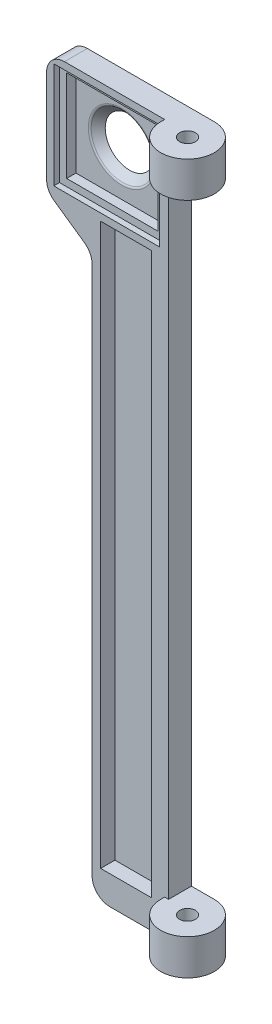
from build123d import *

# Parameters (mm, degrees)
SKETCH1_W           = 15.875
SKETCH1_H           = 125.984
SKETCH1_W_2         = 1.905
SKETCH1_H_2         = 115.824
BOSS_EXTRUDE1_DEPTH = 4.064
SKETCH2_W           = 7.112
SKETCH2_H           = 115.824
CUT_EXTRUDE1_DEPTH  = 2.54
FILLET1_R           = 0.508
BOSS_EXTRUDE2_START = -4.064
SKETCH3_W           = 23.9522
SKETCH3_H           = 21.336
BOSS_EXTRUDE2_DEPTH = 4.064
SKETCH4_W           = 16.256
SKETCH4_H           = 16.256
CUT_EXTRUDE2_DEPTH  = 2.667
SKETCH5_W           = 18.796
SKETCH5_H           = 18.796
CUT_EXTRUDE3_DEPTH  = 1.016
SKETCH6_R           = 5.715
CUT_EXTRUDE4_DEPTH  = 2.54
CUT_EXTRUDE4_DRAFT  = -45
CHAMFER1_SIZE       = 8.128
CHAMFER1_SIZE_2     = 5.691286871
FILLET3_R           = 3.175
FILLET4_R           = 0.508
SKETCH7_W           = 2.286
SKETCH7_H           = 113.284
CUT_EXTRUDE5_DEPTH  = 128.045267433
BOSS_EXTRUDE3_DEPTH = 6.35
BOSS_EXTRUDE4_DEPTH = 6.35
SKETCH10_R          = 1.397
CUT_EXTRUDE6_DEPTH  = 129.316594879


with BuildPart() as part:
    # Sketch1 → Boss-Extrude1 (new body)
    with BuildSketch(Plane.XY):
        with Locations((7.9375, 62.992)):
            Rectangle(SKETCH1_W, SKETCH1_H)
        with Locations((9.5885, 62.992)):
            Rectangle(SKETCH1_W_2, SKETCH1_H_2, mode=Mode.SUBTRACT)
    extrude(amount=BOSS_EXTRUDE1_DEPTH)

    # Sketch2 → Cut-Extrude1 (cut)
    with BuildSketch(Plane.XY.offset(4.064)):
        with Locations((5.08, 62.992)):
            Rectangle(SKETCH2_W, SKETCH2_H)
    extrude(amount=-CUT_EXTRUDE1_DEPTH, mode=Mode.SUBTRACT)

    # Fillet1
    fillet1_edges = [part.edges().sort_by_distance(p)[0] for p in [
        (8.636, 62.992, 1.524),
    ]]
    fillet(fillet1_edges, radius=FILLET1_R)

    # Sketch3 → Boss-Extrude2 (add)
    with BuildSketch(Plane(origin=(0, 0, 0), x_dir=(-1, 0, 0), z_dir=(0, 0, -1)).offset(BOSS_EXTRUDE2_START)):
        with Locations((-3.8989, 115.316)):
            Rectangle(SKETCH3_W, SKETCH3_H)
    extrude(amount=BOSS_EXTRUDE2_DEPTH)

    # Sketch4 → Cut-Extrude2 (cut)
    with BuildSketch(Plane.XY.offset(4.064)):
        with Locations((2.5908, 115.316)):
            Rectangle(SKETCH4_W, SKETCH4_H)
    extrude(amount=-CUT_EXTRUDE2_DEPTH, mode=Mode.SUBTRACT)

    # Sketch5 → Cut-Extrude3 (cut)
    with BuildSketch(Plane.XY.offset(4.064)):
        with Locations((2.5908, 115.316)):
            Rectangle(SKETCH5_W, SKETCH5_H)
    extrude(amount=-CUT_EXTRUDE3_DEPTH, mode=Mode.SUBTRACT)


with BuildPart() as cut_extrude4_tool:
    # Sketch6 → Cut-Extrude4 (with draft: the straight prism first)
    with BuildSketch(Plane.XY.offset(1.397)):
        with Locations((2.5908, 115.316)):
            Circle(SKETCH6_R)
    extrude(amount=-CUT_EXTRUDE4_DEPTH)
    # Cut-Extrude4: the draft: its side faces are tilted about the plane it starts from
    cut_extrude4_sides = [cut_extrude4_tool.faces().sort_by_distance(p)[0] for p in [
        (-3.1242, 115.316, 0.127),
    ]]
    draft(cut_extrude4_sides, Plane.XY.offset(1.397), CUT_EXTRUDE4_DRAFT)


with BuildPart() as part_1:
    add(part.part)

    # Cut-Extrude4: cut by cut_extrude4_tool
    add(cut_extrude4_tool.part, mode=Mode.SUBTRACT)

    # Chamfer1
    # the kernel refuses this chamfer: 8.128, 5.691286871 mm, written as the material it adds along each edge
    with BuildSketch(Plane(origin=(0, 104.648, 4.064), x_dir=(-0.9997533347641298, 0.022209674198457242, 0), z_dir=(0, 0, -1))) as chamfer1_piece_1_section:
        Polygon((CHAMFER1_SIZE * 0.999753334764, -CHAMFER1_SIZE * 0.0222096741985), (-CHAMFER1_SIZE_2 * 0.0222096741968, -CHAMFER1_SIZE_2 * 0.999753334688), (0, 0), align=None)
    chamfer1_piece_1 = extrude(amount=4.064, mode=Mode.PRIVATE)
    chamfer1_piece_1 = split(chamfer1_piece_1, bisect_by=Plane(origin=(-8.0772, 102.794358519, 2.032), z_dir=(1, 0, 0)), keep=Keep.TOP, mode=Mode.PRIVATE)
    add(chamfer1_piece_1)

    # Fillet3
    fillet3_edges = [part_1.edges().sort_by_distance(p)[0] for p in [
        (0, 98.956713129, 2.032),
        (-8.0772, 104.612429457, 2.032),
        (-8.0772, 125.984, 2.032),
        (0, 0, 2.032),
    ]]
    fillet(fillet3_edges, radius=FILLET3_R)

    # Fillet4
    fillet4_edges = [part_1.edges().sort_by_distance(p)[0] for p in [
        (-3.1242, 115.316, 1.397),
    ]]
    fillet(fillet4_edges, radius=FILLET4_R)

    # Sketch7 → Cut-Extrude5 (cut, through all)
    with BuildSketch(Plane(origin=(0, 0, 0), x_dir=(-1, 0, 0), z_dir=(0, 0, -1))):
        with Locations((-14.732, 62.992)):
            Rectangle(SKETCH7_W, SKETCH7_H)
    extrude(amount=-CUT_EXTRUDE5_DEPTH, mode=Mode.SUBTRACT)

    # Sketch8 → Boss-Extrude3 (add)
    with BuildSketch(Plane(origin=(0, 125.984, 0), x_dir=(1, 0, 0), z_dir=(0, 1, 0))):
        with BuildLine():
            Line((15.875, 0), (17.653, 0))
            ThreePointArc((17.653, 0), (21.020596045, -8.130096045), (12.8905, -4.7625))
            Line((12.8905, -4.7625), (12.8905, -4.064))
            Line((12.8905, -4.064), (15.875, -4.064))
            Line((15.875, -4.064), (15.875, 0))
        make_face()
    extrude(amount=-BOSS_EXTRUDE3_DEPTH)

    # Sketch9 → Boss-Extrude4 (add)
    with BuildSketch(Plane(origin=(0, 6.35, 0), x_dir=(1, 0, 0), z_dir=(0, 1, 0))):
        with BuildLine():
            Line((17.653, 0), (13.589, 0))
            Line((13.589, 0), (13.589, -4.064))
            Line((13.589, -4.064), (12.8905, -4.064))
            Line((12.8905, -4.064), (12.8905, -4.7625))
            ThreePointArc((12.8905, -4.7625), (21.020596045, -8.130096045), (17.653, 0))
        make_face()
    extrude(amount=-BOSS_EXTRUDE4_DEPTH)

    # Sketch10 → Cut-Extrude6 (cut, through all)
    with BuildSketch(Plane(origin=(0, 125.984, 0), x_dir=(1, 0, 0), z_dir=(0, 1, 0))):
        with Locations(Location((17.653, -4.7625, 0), (0, 0, 270))):
            Circle(SKETCH10_R)
    extrude(amount=-CUT_EXTRUDE6_DEPTH, mode=Mode.SUBTRACT)


solid = part_1.part
